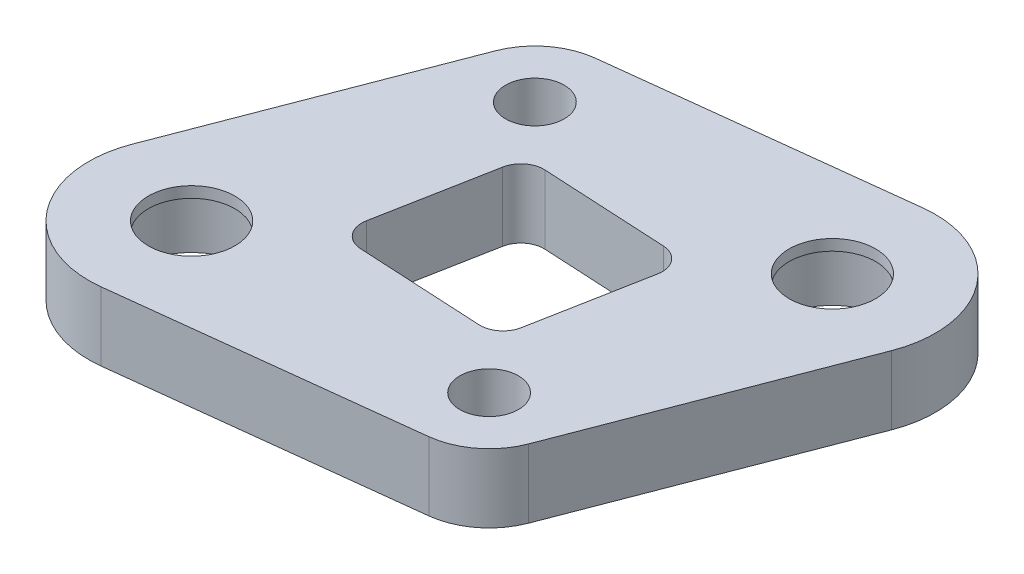
from build123d import *

# Parameters (mm, degrees)
SKETCH1_R           = 4.05
SKETCH1_R_2         = 2.032
BOSS_EXTRUDE1_DEPTH = 4.7625
BOSS_EXTRUDE2_START = -0.7625
SKETCH2_R           = 4.05
SKETCH2_R_2         = 3
BOSS_EXTRUDE2_DEPTH = 0.7625


with BuildPart() as part:
    # Sketch1 → Boss-Extrude1 (new body)
    with BuildSketch(Plane(origin=(0, 0, 0), x_dir=(1, 0, 0), z_dir=(0, 1, 0))):
        with BuildLine():
            Line((0.31636852, 20.75684537), (-6.669197219, 2.560268055))
            ThreePointArc((-6.669197219, 2.560268055), (-5.643741686, -4.37965111), (0.824278846, -7.096036108))
            Line((0.824278846, -7.096036108), (21.187019231, -4.730690739))
            ThreePointArc((21.187019231, -4.730690739), (23.557267407, -3.762494457), (25.08363148, -1.70684537))
            Line((25.08363148, -1.70684537), (32.069197219, 16.489731945))
            ThreePointArc((32.069197219, 16.489731945), (31.043741686, 23.42965111), (24.575721154, 26.146036108))
            Line((24.575721154, 26.146036108), (4.212980769, 23.780690739))
            ThreePointArc((4.212980769, 23.780690739), (1.842732593, 22.812494457), (0.31636852, 20.75684537))
        make_face()
        Circle(SKETCH1_R, mode=Mode.SUBTRACT)
        with Locations((25.4, 19.05)):
            Circle(SKETCH1_R, mode=Mode.SUBTRACT)
        with Locations((20.6375, 0)):
            Circle(SKETCH1_R_2, mode=Mode.SUBTRACT)
        with Locations((4.7625, 19.05)):
            Circle(SKETCH1_R_2, mode=Mode.SUBTRACT)
        with BuildLine():
            Line((7.527921513, 4.190425609), (16.202386897, 3.731925143))
            ThreePointArc((16.202386897, 3.731925143), (17.266640314, 4.068672028), (17.846127168, 5.022731138))
            Line((17.846127168, 5.022731138), (19.348233823, 12.97980626))
            ThreePointArc((19.348233823, 12.97980626), (19.036826198, 14.254748277), (17.872078487, 14.859574391))
            Line((17.872078487, 14.859574391), (9.197613103, 15.318074857))
            ThreePointArc((9.197613103, 15.318074857), (8.133359686, 14.981327972), (7.553872832, 14.027268862))
            Line((7.553872832, 14.027268862), (6.051766177, 6.07019374))
            ThreePointArc((6.051766177, 6.07019374), (6.363173802, 4.795251723), (7.527921513, 4.190425609))
        make_face(mode=Mode.SUBTRACT)
    extrude(amount=BOSS_EXTRUDE1_DEPTH)

    # Sketch2 → Boss-Extrude2 (add)
    # profile 1 of 2: a face of its own
    with BuildSketch(Plane(origin=(0, 4.7625, 0), x_dir=(1, 0, 0), z_dir=(0, 1, 0)).offset(BOSS_EXTRUDE2_START)):
        with Locations((25.4, 19.05)):
            Circle(SKETCH2_R)
        with Locations((25.4, 19.05)):
            Circle(SKETCH2_R_2, mode=Mode.SUBTRACT)
    # profile 2 of 2: a face of its own
    with BuildSketch(Plane(origin=(0, 4.7625, 0), x_dir=(1, 0, 0), z_dir=(0, 1, 0)).offset(BOSS_EXTRUDE2_START)):
        Circle(SKETCH2_R)
        Circle(SKETCH2_R_2, mode=Mode.SUBTRACT)
    extrude(amount=BOSS_EXTRUDE2_DEPTH)


solid = part.part
